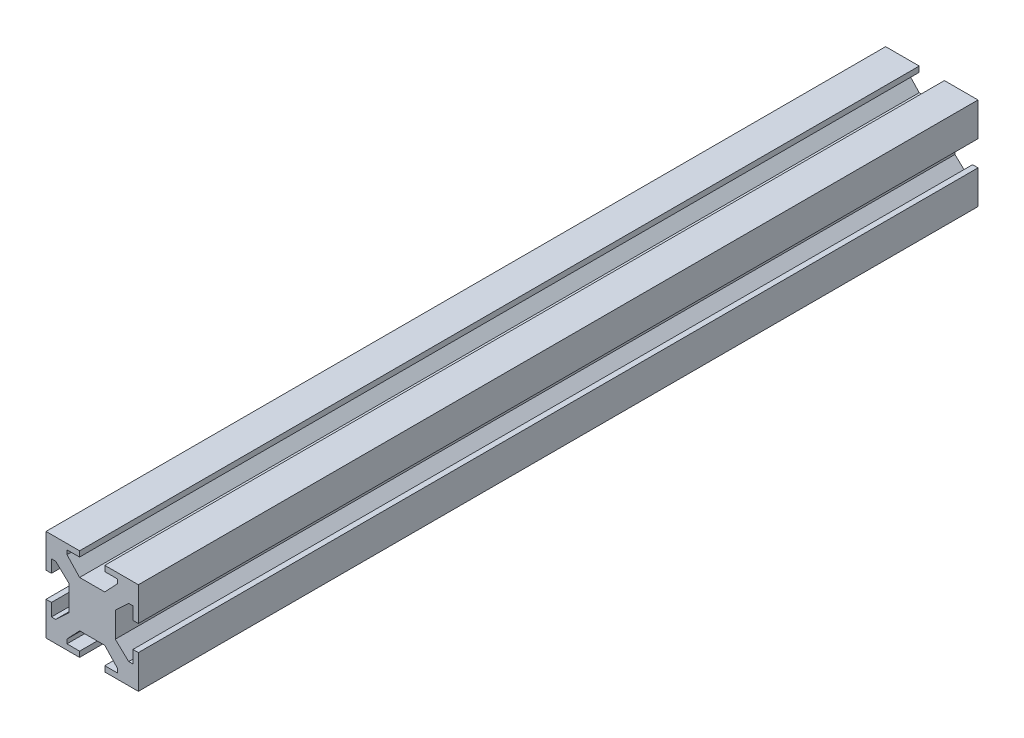
from build123d import *

# Parameters (mm, degrees)
BOSS_EXTRUDE1_DEPTH = 200


with BuildPart() as part:
    # Sketch1 → Boss-Extrude1 (new body)
    with BuildSketch(Plane.XY):
        Polygon((22, 0), (14, 0), (14, -1.3), (17, -1.3), (17, -2.3), (14, -5.5), (8, -5.5), (5, -2.3), (5, -1.3), (8, -1.3), (8, 0), (0, 0), (0, -8), (1.3, -8), (1.3, -5), (2.3, -5), (5.5, -8), (5.5, -14), (2.3, -17), (1.3, -17), (1.3, -14), (0, -14), (0, -22), (8, -22), (8, -20.7), (5, -20.7), (5, -19.7), (8, -16.5), (14, -16.5), (17, -19.7), (17, -20.7), (14, -20.7), (14, -22), (22, -22), (22, -14), (20.7, -14), (20.7, -17), (19.7, -17), (16.5, -14), (16.5, -8), (19.7, -5), (20.7, -5), (20.7, -8), (22, -8), align=None)
    extrude(amount=BOSS_EXTRUDE1_DEPTH)


solid = part.part
